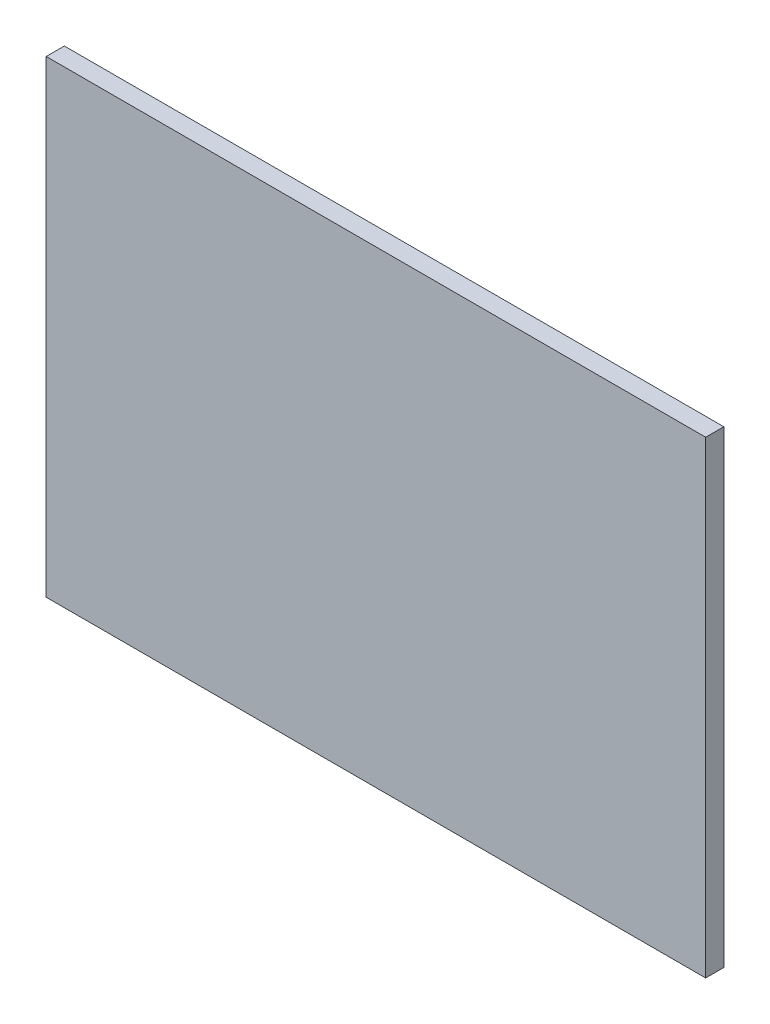
from build123d import *

# Parameters (mm, degrees)
SKETCH1_W          = 69
SKETCH1_H          = 49
BASE_FLANGE1_DEPTH = 1.89738


# Sheet-metal steps are written as plain solids
with BuildPart() as part:
    # Sketch1 → Base-Flange1 (new body)
    with BuildSketch(Plane.XY):
        with Locations((3.386394684, 6.927314943)):
            Rectangle(SKETCH1_W, SKETCH1_H)
    extrude(amount=-BASE_FLANGE1_DEPTH)


solid = part.part
